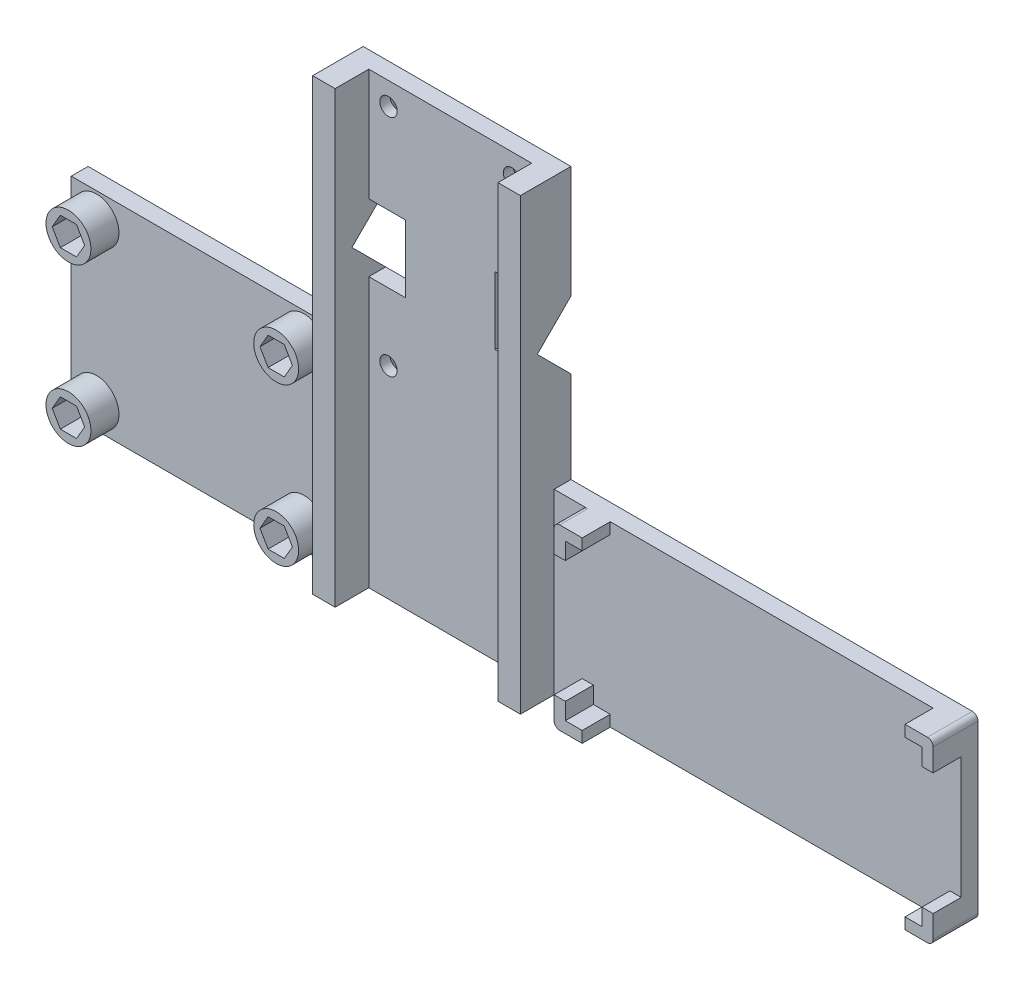
from build123d import *

# Parameters (mm, degrees)
BOSS_EXTRUDE1_START                               = 19.95
BOSS_EXTRUDE1_DEPTH                               = 4
SKETCH2_W                                         = 33
SKETCH2_H                                         = 60
BOSS_EXTRUDE2_DEPTH                               = 3
CUT_EXTRUDE1_DEPTH                                = 4
SKETCH4_W                                         = 29
SKETCH4_H                                         = 3
CUT_EXTRUDE2_DEPTH                                = 12
SKETCH5_W                                         = 22.5
SKETCH5_H                                         = 3
BOSS_EXTRUDE3_DEPTH                               = 12
BOSS_EXTRUDE4_DEPTH                               = 20
SKETCH7_W                                         = 6.5
SKETCH7_H                                         = 3
CUT_EXTRUDE3_DEPTH                                = 12
BOSS_EXTRUDE5_DEPTH                               = 4
SKETCH9_W                                         = 3
SKETCH9_H                                         = 37
BOSS_EXTRUDE6_DEPTH                               = 49
SKETCH10_W                                        = 3
SKETCH10_H                                        = 31.7
BOSS_EXTRUDE7_DEPTH                               = 72.5
CSK_FOR_M2_5_FLAT_HEAD_MACHINE_SCREW1_D           = 3.1
CSK_FOR_M2_5_FLAT_HEAD_MACHINE_SCREW1_CSINK_D     = 5.5
CSK_FOR_M2_5_FLAT_HEAD_MACHINE_SCREW1_CSINK_ANGLE = 90
BOSS_EXTRUDE8_DEPTH                               = 5
FILLET1_R                                         = 1
SKETCH26_R                                        = 4
BOSS_EXTRUDE10_DEPTH                              = 5
CUT_EXTRUDE4_DEPTH                                = 6.5


with BuildPart() as part:
    # Boss-Extrude1: read off the stored shape, not the designer's step
    # Boss-Extrude1 outline → Boss-Extrude1 (new body)
    with BuildSketch(Plane.YZ.offset(BOSS_EXTRUDE1_START)):
        Polygon((108.604346835, -99.936709039), (108.604346835, -93.936709039), (48.604346835, -93.936709039), (48.604346835, -99.936709039), (99.604346835, -99.936709039), (102.604346835, -96.936709039), (105.604346835, -99.936709039), align=None)
    extrude(amount=BOSS_EXTRUDE1_DEPTH)

    # Sketch2 → Boss-Extrude2 (add)
    with BuildSketch(Plane(origin=(0, 0, -99.936709039), x_dir=(-1, 0, 0), z_dir=(0, 0, -1))):
        with Locations((-7.45, 78.604346835)):
            Rectangle(SKETCH2_W, SKETCH2_H)
    extrude(amount=BOSS_EXTRUDE2_DEPTH)

    # Sketch3 → Cut-Extrude1 (cut)
    with BuildSketch(Plane(origin=(23.95, 0, 0), x_dir=(0, 0, -1), z_dir=(1, 0, 0))):
        Polygon((99.936709039, 99.604346835), (102.936709039, 96.604346835), (102.936709039, 108.604346835), (99.936709039, 105.604346835), align=None)
    extrude(amount=-CUT_EXTRUDE1_DEPTH, mode=Mode.SUBTRACT)

    # Sketch4 → Cut-Extrude2 (cut)
    with BuildSketch(Plane(origin=(0, 108.604346835, 0), x_dir=(-1, 0, 0), z_dir=(0, 1, 0))):
        with Locations((-5.45, -101.436709039)):
            Rectangle(SKETCH4_W, SKETCH4_H)
    extrude(amount=-CUT_EXTRUDE2_DEPTH, mode=Mode.SUBTRACT)

    # Sketch5 → Boss-Extrude3 (add)
    with BuildSketch(Plane(origin=(0, 96.604346835, 0), x_dir=(-1, 0, 0), z_dir=(0, 1, 0))):
        with Locations((-2.2, -101.436709039)):
            Rectangle(SKETCH5_W, SKETCH5_H)
    extrude(amount=BOSS_EXTRUDE3_DEPTH)

    # Sketch6 → Boss-Extrude4 (add)
    with BuildSketch(Plane(origin=(0, 108.604346835, 0), x_dir=(-1, 0, 0), z_dir=(0, 1, 0))):
        Polygon((9.05, -99.936709039), (9.05, -102.936709039), (-23.95, -102.936709039), (-23.95, -93.936709039), (-19.95, -93.936709039), (-19.95, -99.936709039), align=None)
    extrude(amount=BOSS_EXTRUDE4_DEPTH)

    # Sketch7 → Cut-Extrude3 (cut)
    with BuildSketch(Plane(origin=(0, 108.604346835, 0), x_dir=(1, 0, 0), z_dir=(0, 1, 0))):
        with Locations((-5.8, 101.436709039)):
            Rectangle(SKETCH7_W, SKETCH7_H)
    extrude(amount=-CUT_EXTRUDE3_DEPTH, mode=Mode.SUBTRACT)

    # Sketch8 → Boss-Extrude5 (add)
    with BuildSketch(Plane.ZY.offset(9.05)):
        Polygon((-102.936709039, 96.604346835), (-96.936709039, 102.604346835), (-102.936709039, 108.604346835), (-102.936709039, 128.604346835), (-93.936709039, 128.604346835), (-93.936709039, 48.604346835), (-102.936709039, 48.604346835), align=None)
    extrude(amount=BOSS_EXTRUDE5_DEPTH)

    # Sketch9 → Boss-Extrude6 (add)
    with BuildSketch(Plane.ZY.offset(13.05)):
        with Locations((-101.436709039, 67.104346835)):
            Rectangle(SKETCH9_W, SKETCH9_H)
    extrude(amount=BOSS_EXTRUDE6_DEPTH)

    # Sketch10 → Boss-Extrude7 (add)
    with BuildSketch(Plane(origin=(23.95, 0, 0), x_dir=(0, 0, -1), z_dir=(1, 0, 0))):
        with Locations((101.436709039, 64.454346835)):
            Rectangle(SKETCH10_W, SKETCH10_H)
    extrude(amount=BOSS_EXTRUDE7_DEPTH)

    # CSK for M2.5 Flat Head Machine Screw1 (through all)
    with Locations(Plane(origin=(0, 0, -102.936709039), x_dir=(-1, 0, 0), z_dir=(0, 0, -1))):
        with Locations((-16.45, 124.604346835), (-16.45, 84.604346835), (5.55, 124.604346835), (5.55, 84.604346835)):
            CounterSinkHole(CSK_FOR_M2_5_FLAT_HEAD_MACHINE_SCREW1_D / 2, CSK_FOR_M2_5_FLAT_HEAD_MACHINE_SCREW1_CSINK_D / 2, counter_sink_angle=CSK_FOR_M2_5_FLAT_HEAD_MACHINE_SCREW1_CSINK_ANGLE)

    # Sketch24 → Boss-Extrude8 (add)
    with BuildSketch(Plane.XY.offset(-99.936709039)):
        Polygon((28.95, 75.304346835), (28.95, 80.304346835), (33.95, 80.304346835), (33.95, 78.304346835), (30.95, 78.304346835), (30.95, 75.304346835), align=None)
        Polygon((91.45, 78.304346835), (91.45, 80.304346835), (96.45, 80.304346835), (96.45, 75.304346835), (94.45, 75.304346835), (94.45, 78.304346835), align=None)
        Polygon((28.95, 53.604346835), (28.95, 48.604346835), (33.95, 48.604346835), (33.95, 50.604346835), (30.95, 50.604346835), (30.95, 53.604346835), align=None)
        Polygon((96.45, 53.604346835), (96.45, 48.604346835), (91.45, 48.604346835), (91.45, 50.604346835), (94.45, 50.604346835), (94.45, 53.604346835), align=None)
    extrude(amount=BOSS_EXTRUDE8_DEPTH)

    # Fillet1
    fillet1_edges = [part.edges().sort_by_distance(p)[0] for p in [
        (96.45, 80.304346835, -98.936709039),
        (96.45, 48.604346835, -98.936709039),
        (28.95, 80.304346835, -97.436709039),
        (28.95, 48.604346835, -97.436709039),
    ]]
    fillet(fillet1_edges, radius=FILLET1_R)

    # Sketch26 → Boss-Extrude10 (add)
    with BuildSketch(Plane.XY.offset(-99.936709039)):
        with Locations(Location((-57.55, 81.104346835, 0), (0, 0, 90))):
            Circle(SKETCH26_R)
        with Locations(Location((-20.55, 81.104346835, 0), (0, 0, 90))):
            Circle(SKETCH26_R)
        with Locations(Location((-20.55, 53.104346835, 0), (0, 0, 90))):
            Circle(SKETCH26_R)
        with Locations(Location((-57.55, 53.104346835, 0), (0, 0, 90))):
            Circle(SKETCH26_R)
    extrude(amount=BOSS_EXTRUDE10_DEPTH)

    # Sketch27 → Cut-Extrude4 (cut)
    with BuildSketch(Plane.XY.offset(-94.936709039)):
        Polygon((-54.663248654, 81.104346835), (-56.106624327, 83.604346835), (-58.993375673, 83.604346835), (-60.436751346, 81.104346835), (-58.993375673, 78.604346835), (-56.106624327, 78.604346835), align=None)
        Polygon((-17.663248654, 81.104346835), (-19.106624327, 83.604346835), (-21.993375673, 83.604346835), (-23.436751346, 81.104346835), (-21.993375673, 78.604346835), (-19.106624327, 78.604346835), align=None)
        Polygon((-17.663248654, 53.104346835), (-19.106624327, 55.604346835), (-21.993375673, 55.604346835), (-23.436751346, 53.104346835), (-21.993375673, 50.604346835), (-19.106624327, 50.604346835), align=None)
        Polygon((-54.663248654, 53.104346835), (-56.106624327, 55.604346835), (-58.993375673, 55.604346835), (-60.436751346, 53.104346835), (-58.993375673, 50.604346835), (-56.106624327, 50.604346835), align=None)
    extrude(amount=-CUT_EXTRUDE4_DEPTH, mode=Mode.SUBTRACT)


solid = part.part
